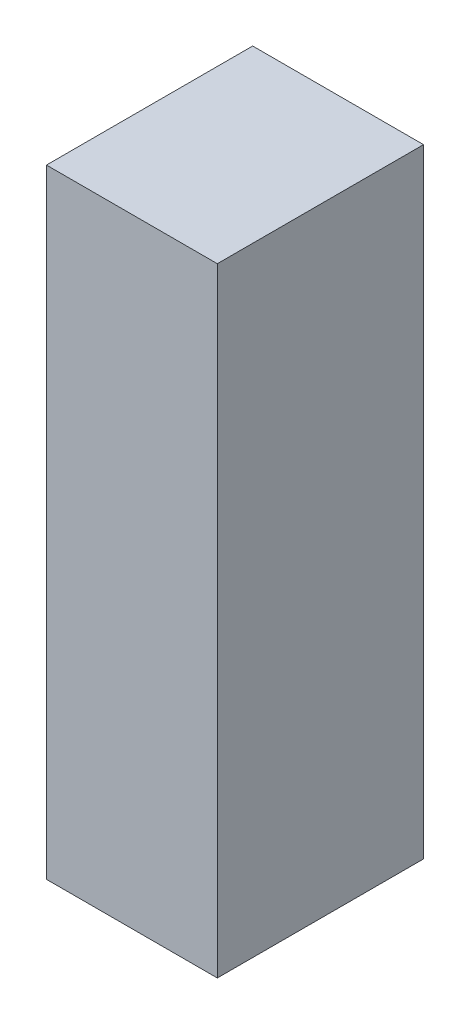
from build123d import *

# Parameters (mm, degrees)
SKETCH1_W           = 29
SKETCH1_H           = 35
BOSS_EXTRUDE1_DEPTH = 105


with BuildPart() as part:
    # Sketch1 → Boss-Extrude1 (new body)
    with BuildSketch(Plane(origin=(0, 0, 0), x_dir=(1, 0, 0), z_dir=(0, 1, 0))):
        with Locations((14.5, 17.5)):
            Rectangle(SKETCH1_W, SKETCH1_H)
    extrude(amount=BOSS_EXTRUDE1_DEPTH)


solid = part.part
